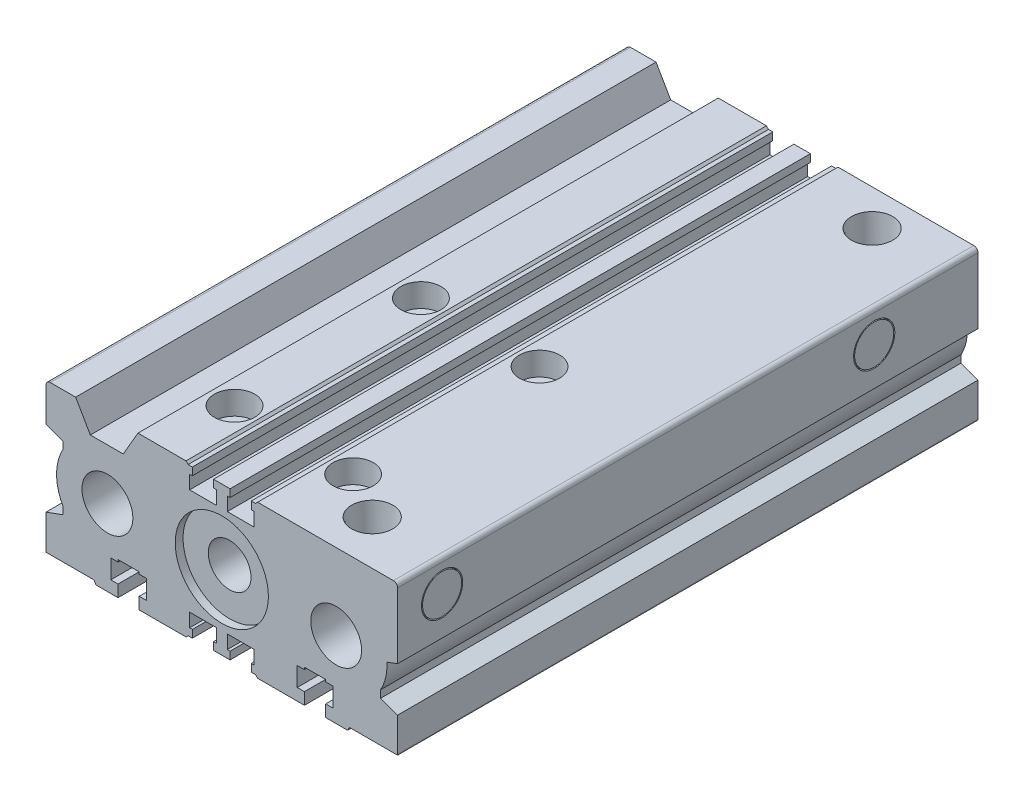
from build123d import *

# Parameters (mm, degrees)
BASE_EXTRUDE_DEPTH                 = 68.5
BASE_EXTRUDE_DEPTH_BACK            = 68.5
SKETCH1_W                          = 83
SKETCH1_H                          = 36
FILLET1_START                      = -68.5
FILLET1_OUTLINE_R                  = 6
FILLET1_DEPTH                      = 137
T_GROOVES_START                    = -137
T_GROOVES_OUTLINE_R                = 6
T_GROOVES_DEPTH                    = 137
SWITCHGROOVES_DEPTH                = 145.274911194
SKETCH8_R                          = 6
GUIDERODTHRUBORES_DEPTH            = 145.274911194
STROKECHAMBER_START                = -52.5
STROKECHAMBER_OUTLINE_R            = 10
STROKECHAMBER_DEPTH                = 105
STROKECHAMBER_START_2              = -69
STROKECHAMBER_2_DEPTH              = 138
SKETCH3_R                          = 11
FRONTDETAIL_DEPTH                  = 1.85
RODTHRUBORE_REACH                  = 144.519
SKETCH4_R                          = 5.05
SKETCH14_R                         = 4.865
PORTS_DEPTH                        = 9.73
PORTS_DRAFT                        = -3
PORTS_PROFILE_2_DEPTH              = 9.73
PORTS_PROFILE_2_DRAFT              = -3
SKETCH15_R                         = 2.8
THRUHOLES_DEPTH                    = 88.809452794
SKETCH16_R                         = 4.75
CBORES_DEPTH                       = 5.5
SKETCH17_R                         = 1.5
BLINDHOLESBOTTOM_DEPTH             = 4
SKETCH25_R                         = 1.5
PINHOLES_DEPTH                     = 6
PINSLOT_DEPTH                      = 3
SKETCH18_R                         = 4.865
PLUGCUT_DEPTH                      = 1
SKETCH19_R                         = 4.615
PLUG_DEPTH                         = 1
TOPRELIEF_DEPTH                    = 145.274911194
VCUT_DEPTH                         = 145.274911194
SKETCH23_R                         = 3
C_BORE_DEPTH                       = 12
SKETCH24_R                         = 2.5
CUT_EXTRUDE2_DEPTH                 = 13
F_12_40_MATERIAL_SAVER1_DEPTH      = 83.08836702
F_12_40_MATERIAL_SAVER1_DEPTH_BACK = 83.08836702


with BuildPart() as part:
    # Sketch1 → Base-Extrude (new, two sides: drawn at the far end of the back side and taken through both)
    with BuildSketch(Plane.XY.offset(-BASE_EXTRUDE_DEPTH_BACK)):
        Rectangle(SKETCH1_W, SKETCH1_H)
    extrude(amount=BASE_EXTRUDE_DEPTH + BASE_EXTRUDE_DEPTH_BACK)

    # Fillet1: read off the stored shape, not the designer's step
    # Fillet1 outline → Fillet1 (cut)
    with BuildSketch(Plane.XY.offset(FILLET1_START)):
        Polygon((-26.2, -15.2), (-24.5, -15.2), (-24.5, -18), (-19.5, -18), (-19.5, -15.2), (-17.8, -15.2), (-17.8, -10.7), (-19.5, -10.7), (-19.5, -10.2), (-24.5, -10.2), (-24.5, -10.7), (-26.2, -10.7), align=None)
        with BuildLine():
            Line((-41.5, -18), (-40.5, -18))
            ThreePointArc((-40.5, -18), (-41.207106781, -17.707106781), (-41.5, -17))
            Line((-41.5, -17), (-41.5, -18))
        make_face()
        Polygon((-6.95, -15.7), (-6.95, -18), (-1.95, -18), (-1.95, -15.7), (-1.3, -15.7), (-1.3, -12.5), (-7.6, -12.5), (-7.6, -15.7), align=None)
        with BuildLine():
            Line((-41.5, 18), (-41.5, 17))
            ThreePointArc((-41.5, 17), (-41.207106781, 17.707106781), (-40.5, 18))
            Line((-40.5, 18), (-41.5, 18))
        make_face()
        Polygon((1.95, -15.7), (1.95, -18), (6.95, -18), (6.95, -15.7), (7.6, -15.7), (7.6, -12.5), (1.3, -12.5), (1.3, -15.7), align=None)
        Polygon((-1.95, 18), (-6.95, 18), (-6.95, 15.7), (-7.6, 15.7), (-7.6, 12.5), (-1.3, 12.5), (-1.3, 15.7), (-1.95, 15.7), align=None)
        Polygon((19.5, -15.2), (19.5, -18), (24.5, -18), (24.5, -15.2), (26.2, -15.2), (26.2, -10.7), (24.5, -10.7), (24.5, -10.2), (19.5, -10.2), (19.5, -10.7), (17.8, -10.7), (17.8, -15.2), align=None)
        Polygon((6.95, 18), (1.95, 18), (1.95, 15.7), (1.3, 15.7), (1.3, 12.5), (7.6, 12.5), (7.6, 15.7), (6.95, 15.7), align=None)
        with BuildLine():
            ThreePointArc((41.5, -17), (41.207106781, -17.707106781), (40.5, -18))
            Line((40.5, -18), (41.5, -18))
            Line((41.5, -18), (41.5, -17))
        make_face()
        with BuildLine():
            Line((41.5, 18), (40.5, 18))
            ThreePointArc((40.5, 18), (41.207106781, 17.707106781), (41.5, 17))
            Line((41.5, 17), (41.5, 18))
        make_face()
        with Locations((27, 0)):
            Circle(FILLET1_OUTLINE_R)
        with Locations((-27, 0)):
            Circle(FILLET1_OUTLINE_R)
    extrude(amount=FILLET1_DEPTH, mode=Mode.SUBTRACT)

    # T-Grooves: read off the stored shape, not the designer's step
    # T-Grooves outline → T-Grooves (add)
    with BuildSketch(Plane.XY.offset(68.5).offset(T_GROOVES_START)):
        Polygon((-7.6, -15.7), (-6.95, -15.7), (-6.95, -18), (-1.95, -18), (-1.95, -15.7), (-1.3, -15.7), (-1.3, -12.5), (-7.6, -12.5), align=None)
        Polygon((1.95, -15.7), (1.95, -18), (6.95, -18), (6.95, -15.7), (7.6, -15.7), (7.6, -12.5), (1.3, -12.5), (1.3, -15.7), align=None)
        with BuildLine():
            ThreePointArc((-40.5, -18), (-41.207106781, -17.707106781), (-41.5, -17))
            Line((-41.5, -17), (-41.5, -18))
            Line((-41.5, -18), (-40.5, -18))
        make_face()
        with BuildLine():
            ThreePointArc((-41.5, 17), (-41.207106781, 17.707106781), (-40.5, 18))
            Line((-40.5, 18), (-41.5, 18))
            Line((-41.5, 18), (-41.5, 17))
        make_face()
        with BuildLine():
            Line((41.5, -18), (41.5, -17))
            ThreePointArc((41.5, -17), (41.207106781, -17.707106781), (40.5, -18))
            Line((40.5, -18), (41.5, -18))
        make_face()
        with BuildLine():
            Line((41.5, 18), (40.5, 18))
            ThreePointArc((40.5, 18), (41.207106781, 17.707106781), (41.5, 17))
            Line((41.5, 17), (41.5, 18))
        make_face()
        Polygon((6.95, 18), (1.95, 18), (1.95, 15.7), (1.3, 15.7), (1.3, 12.5), (7.6, 12.5), (7.6, 15.7), (6.95, 15.7), align=None)
        Polygon((-6.95, 18), (-6.95, 15.7), (-7.6, 15.7), (-7.6, 12.5), (-1.3, 12.5), (-1.3, 15.7), (-1.95, 15.7), (-1.95, 18), align=None)
        with Locations((27, 0)):
            Circle(T_GROOVES_OUTLINE_R)
        with Locations((-27, 0)):
            Circle(T_GROOVES_OUTLINE_R)
    extrude(amount=T_GROOVES_DEPTH)

    # Sketch6 → SwitchGrooves (cut, through all)
    with BuildSketch(Plane.XY.offset(68.5)):
        Polygon((-6.95, -18), (-6.95, -15.7), (-7.6, -15.7), (-7.6, -12.5), (-1.3, -12.5), (-1.3, -15.7), (-1.95, -15.7), (-1.95, -18), align=None)
        Polygon((7.6, -12.5), (1.3, -12.5), (1.3, -15.7), (1.95, -15.7), (1.95, -18), (6.95, -18), (6.95, -15.7), (7.6, -15.7), align=None)
    switchgrooves = extrude(amount=-SWITCHGROOVES_DEPTH, mode=Mode.SUBTRACT)

    # TopSwitchGrooves: SwitchGrooves across plane
    add(switchgrooves.mirror(Plane.ZX), mode=Mode.SUBTRACT)

    # Sketch8 → GuideRodThruBores (cut, through all)
    with BuildSketch(Plane.XY.offset(68.5)):
        with Locations((27, 0)):
            Circle(SKETCH8_R)
        with Locations(Location((-27, 0, 0), (0, 0, 180))):
            Circle(SKETCH8_R)
    extrude(amount=-GUIDERODTHRUBORES_DEPTH, mode=Mode.SUBTRACT)

    # StrokeChamber: read off the stored shape, not the designer's step
    # StrokeChamber outline → StrokeChamber (cut)
    with BuildSketch(Plane.XY.offset(STROKECHAMBER_START)):
        with BuildLine():
            Line((41.5, 18), (40.5, 18))
            ThreePointArc((40.5, 18), (41.207106781, 17.707106781), (41.5, 17))
            Line((41.5, 17), (41.5, 18))
        make_face()
        with BuildLine():
            Line((41.5, -18), (41.5, -17))
            ThreePointArc((41.5, -17), (41.207106781, -17.707106781), (40.5, -18))
            Line((40.5, -18), (41.5, -18))
        make_face()
        with BuildLine():
            Line((-41.5, 18), (-41.5, 17))
            ThreePointArc((-41.5, 17), (-41.207106781, 17.707106781), (-40.5, 18))
            Line((-40.5, 18), (-41.5, 18))
        make_face()
        with BuildLine():
            ThreePointArc((-40.5, -18), (-41.207106781, -17.707106781), (-41.5, -17))
            Line((-41.5, -17), (-41.5, -18))
            Line((-41.5, -18), (-40.5, -18))
        make_face()
        Circle(STROKECHAMBER_OUTLINE_R)
    extrude(amount=STROKECHAMBER_DEPTH, mode=Mode.SUBTRACT)

    # StrokeChamber 2 outline → StrokeChamber 2 (cut)
    with BuildSketch(Plane.XY.offset(STROKECHAMBER_START_2)):
        with BuildLine():
            Line((41.5, 18), (40.5, 18))
            ThreePointArc((40.5, 18), (41.207106781, 17.707106781), (41.5, 17))
            Line((41.5, 17), (41.5, 18))
        make_face()
        with BuildLine():
            Line((41.5, -18), (41.5, -17))
            ThreePointArc((41.5, -17), (41.207106781, -17.707106781), (40.5, -18))
            Line((40.5, -18), (41.5, -18))
        make_face()
        with BuildLine():
            Line((-41.5, 18), (-41.5, 17))
            ThreePointArc((-41.5, 17), (-41.207106781, 17.707106781), (-40.5, 18))
            Line((-40.5, 18), (-41.5, 18))
        make_face()
        with BuildLine():
            ThreePointArc((-40.5, -18), (-41.207106781, -17.707106781), (-41.5, -17))
            Line((-41.5, -17), (-41.5, -18))
            Line((-41.5, -18), (-40.5, -18))
        make_face()
    extrude(amount=STROKECHAMBER_2_DEPTH, mode=Mode.SUBTRACT)

    # Sketch3 → FrontDetail (cut)
    with BuildSketch(Plane.XY.offset(68.5)):
        Circle(SKETCH3_R)
    frontdetail = extrude(amount=-FRONTDETAIL_DEPTH, mode=Mode.SUBTRACT)

    # Mirror1: FrontDetail across plane
    add(frontdetail.mirror(Plane.XY), mode=Mode.SUBTRACT)

    # Sketch4 → RodThruBore (cut, up to next)
    with BuildSketch(Plane.XY.offset(66.65), mode=Mode.PRIVATE) as rodthrubore_sk1:
        Circle(SKETCH4_R)
    rodthrubore_tool1 = extrude(rodthrubore_sk1.sketch, amount=-RODTHRUBORE_REACH, mode=Mode.PRIVATE) & part.part
    add(rodthrubore_tool1.solids().sort_by_distance((0, 0, 66.65))[0], mode=Mode.SUBTRACT)


with BuildPart() as ports_tool:
    # Sketch14 → Ports (with draft: the straight prism first)
    with BuildSketch(Plane(origin=(0, 18, 0), x_dir=(-1, 0, 0), z_dir=(0, 1, 0))):
        with Locations((-25, 58)):
            Circle(SKETCH14_R)
    extrude(amount=-PORTS_DEPTH)
    # Ports: the draft: its side faces are tilted about the plane it starts from
    ports_sides = [ports_tool.faces().sort_by_distance(p)[0] for p in [
        (29.865, 13.135, 58),
    ]]
    draft(ports_sides, Plane(origin=(0, 18, 0), x_dir=(-1, 0, 0), z_dir=(0, 1, 0)), PORTS_DRAFT)


with BuildPart() as part_1:
    add(part.part)

    # Ports: cut by ports_tool
    add(ports_tool.part, mode=Mode.SUBTRACT)


with BuildPart() as ports_profile_2_tool:
    # Sketch14 → Ports profile 2 (with draft: the straight prism first)
    with BuildSketch(Plane(origin=(0, 18, 0), x_dir=(-1, 0, 0), z_dir=(0, 1, 0))):
        with Locations((-25, -60)):
            Circle(SKETCH14_R)
    extrude(amount=-PORTS_PROFILE_2_DEPTH)
    # Ports profile 2: the draft: its side faces are tilted about the plane it starts from
    ports_profile_2_sides = [ports_profile_2_tool.faces().sort_by_distance(p)[0] for p in [
        (29.865, 13.135, -60),
    ]]
    draft(ports_profile_2_sides, Plane(origin=(0, 18, 0), x_dir=(-1, 0, 0), z_dir=(0, 1, 0)), PORTS_PROFILE_2_DRAFT)


with BuildPart() as part_2:
    add(part_1.part)

    # Ports profile 2: cut by ports_profile_2_tool
    add(ports_profile_2_tool.part, mode=Mode.SUBTRACT)

    # Sketch15 → ThruHoles (cut, through all)
    with BuildSketch(Plane(origin=(0, 18, 0), x_dir=(-1, 0, 0), z_dir=(0, 1, 0))):
        with Locations(Location((-14, 7.5, 0), (0, 0, 90))):
            Circle(SKETCH15_R)
        with Locations(Location((14, 7.5, 0), (0, 0, 270))):
            Circle(SKETCH15_R)
        with Locations(Location((14, 51.5, 0), (0, 0, 90))):
            Circle(SKETCH15_R)
        with Locations(Location((-14, 51.5, 0), (0, 0, 270))):
            Circle(SKETCH15_R)
    extrude(amount=-THRUHOLES_DEPTH, mode=Mode.SUBTRACT)

    # Sketch16 → Cbores (cut)
    with BuildSketch(Plane(origin=(0, 18, 0), x_dir=(-1, 0, 0), z_dir=(0, 1, 0))):
        with Locations(Location((-14, 7.5, 0), (0, 0, 90))):
            Circle(SKETCH16_R)
        with Locations(Location((14, 7.5, 0), (0, 0, 270))):
            Circle(SKETCH16_R)
        with Locations(Location((14, 51.5, 0), (0, 0, 90))):
            Circle(SKETCH16_R)
        with Locations(Location((-14, 51.5, 0), (0, 0, 270))):
            Circle(SKETCH16_R)
    extrude(amount=-CBORES_DEPTH, mode=Mode.SUBTRACT)

    # Sketch17 → BlindHolesBottom (cut)
    with BuildSketch(Plane.XZ.offset(18)):
        with Locations((14, 29.5)):
            Circle(SKETCH17_R)
        with Locations(Location((-14, 29.5, 0), (0, 0, 180))):
            Circle(SKETCH17_R)
    extrude(amount=-BLINDHOLESBOTTOM_DEPTH, mode=Mode.SUBTRACT)

    # Sketch25 → PinHoles (cut)
    with BuildSketch(Plane(origin=(0, 0, -68.5), x_dir=(-1, 0, 0), z_dir=(0, 0, -1))):
        with Locations((-14, 0)):
            Circle(SKETCH25_R)
        with Locations((14, 0)):
            Circle(SKETCH25_R)
    extrude(amount=-PINHOLES_DEPTH, mode=Mode.SUBTRACT)

    # Sketch26 → PinSlot (cut)
    with BuildSketch(Plane(origin=(0, 0, -68.5), x_dir=(-1, 0, 0), z_dir=(0, 0, -1))):
        with BuildLine():
            Line((13.75, 1.5), (14.25, 1.5))
            ThreePointArc((14.25, 1.5), (15.75, 0), (14.25, -1.5))
            Line((14.25, -1.5), (13.75, -1.5))
            ThreePointArc((13.75, -1.5), (12.25, 0), (13.75, 1.5))
        make_face()
    extrude(amount=-PINSLOT_DEPTH, mode=Mode.SUBTRACT)

    # Sketch18 → PlugCut (cut)
    with BuildSketch(Plane(origin=(41.5, 0, 0), x_dir=(0, 0, -1), z_dir=(1, 0, 0))):
        with Locations(Location((-58, 10.5, 0), (0, 0, 90))):
            Circle(SKETCH18_R)
        with Locations(Location((44, 10.5, 0), (0, 0, 90))):
            Circle(SKETCH18_R)
    extrude(amount=-PLUGCUT_DEPTH, mode=Mode.SUBTRACT)

    # Sketch19 → Plug (add)
    with BuildSketch(Plane(origin=(40.5, 0, 0), x_dir=(0, 0, -1), z_dir=(1, 0, 0))):
        with Locations(Location((-58, 10.5, 0), (0, 0, 270))):
            Circle(SKETCH19_R)
        with Locations(Location((44, 10.5, 0), (0, 0, 270))):
            Circle(SKETCH19_R)
    extrude(amount=PLUG_DEPTH)

    # Sketch20 → TopRelief (cut, through all)
    with BuildSketch(Plane.XY.offset(68.5)):
        Polygon((8.45, 18), (7.95, 17.5), (-7.95, 17.5), (-8.45, 18), align=None)
        Polygon((-8.45, -18), (8.45, -18), (7.95, -17.5), (-7.95, -17.5), align=None)
    extrude(amount=-TOPRELIEF_DEPTH, mode=Mode.SUBTRACT)

    # Sketch22 → VCut (cut, through all)
    with BuildSketch(Plane.XY.offset(68.5)):
        Polygon((-34.5, 18), (-31.035898385, 12), (-23.264101615, 12), (-19.8, 18), align=None)
    extrude(amount=-VCUT_DEPTH, mode=Mode.SUBTRACT)

    # Sketch23 → C-bore (cut)
    with BuildSketch(Plane.XZ.offset(18)):
        with Locations((-14, 51.5)):
            Circle(SKETCH23_R)
        with Locations(Location((14, 51.5, 0), (0, 0, 180))):
            Circle(SKETCH23_R)
        with Locations((-14, 7.5)):
            Circle(SKETCH23_R)
        with Locations((14, 7.5)):
            Circle(SKETCH23_R)
    extrude(amount=-C_BORE_DEPTH, mode=Mode.SUBTRACT)

    # Sketch24 → Cut-Extrude2 (cut)
    with BuildSketch(Plane(origin=(0, 0, -68.5), x_dir=(-1, 0, 0), z_dir=(0, 0, -1))):
        with Locations((-36, 12)):
            Circle(SKETCH24_R)
        with Locations((36, 12)):
            Circle(SKETCH24_R)
        with Locations((36, -12)):
            Circle(SKETCH24_R)
        with Locations((-36, -12)):
            Circle(SKETCH24_R)
    extrude(amount=-CUT_EXTRUDE2_DEPTH, mode=Mode.SUBTRACT)

    # 12-40 Material Saver1 Sketch → 12-40 Material Saver1 (cut, two sides: drawn at the far end of the back side and taken through both)
    with BuildSketch(Plane.XY.offset(-F_12_40_MATERIAL_SAVER1_DEPTH_BACK)):
        Polygon((29.7, -18), (30.161880215, -17.2), (41.5, -17.2), (41.5, -18), align=None)
        Polygon((-41.5, -18), (-29.7, -18), (-30.161880215, -17.2), (-41.5, -17.2), align=None)
        with BuildLine():
            Line((41.5, -9), (37.5, -7.544119063))
            Line((37.5, -7.544119063), (37.5, -5.809475019))
            ThreePointArc((37.5, -5.809475019), (38.688629364, -2.715868848), (38.985737833, 0.58488341))
            Line((38.985737833, 0.58488341), (41.5, 1.5))
            Line((41.5, 1.5), (41.5, -9))
        make_face()
        with BuildLine():
            Line((-41.5, -9), (-37.5, -7.544119063))
            Line((-37.5, -7.544119063), (-37.5, -5.809475019))
            ThreePointArc((-37.5, -5.809475019), (-39, 0), (-37.5, 5.809475019))
            Line((-37.5, 5.809475019), (-37.5, 7.544119063))
            Line((-37.5, 7.544119063), (-41.5, 9))
            Line((-41.5, 9), (-41.5, -9))
        make_face()
    extrude(amount=F_12_40_MATERIAL_SAVER1_DEPTH + F_12_40_MATERIAL_SAVER1_DEPTH_BACK, mode=Mode.SUBTRACT)


solid = part_2.part
